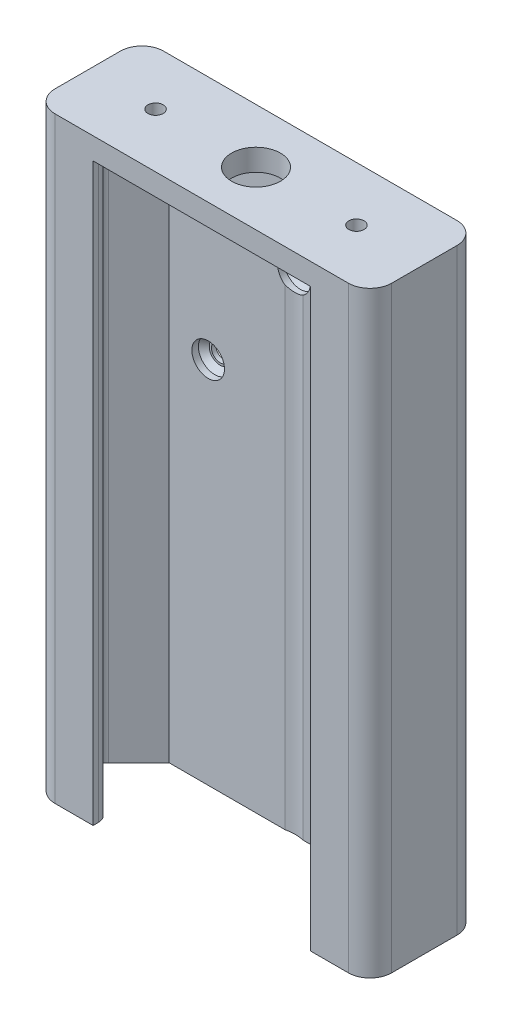
from build123d import *

# Parameters (mm, degrees)
SKETCH1_W           = 62
SKETCH1_H           = 110
SKETCH1_R           = 1.6
SKETCH1_R_2         = 1.7
BOSS_EXTRUDE1_DEPTH = 20
CUT_EXTRUDE1_START  = -55
CUT_EXTRUDE1_DEPTH  = 106
FILLET1_R           = 4
CUT_EXTRUDE3_REACH  = 118.022
SKETCH3_R           = 4.5
SKETCH3_R_2         = 1.4
SKETCH6_R           = 3
CUT_EXTRUDE5_DEPTH  = 2.2
SKETCH7_R           = 1.4
CUT_EXTRUDE6_DEPTH  = 10
SKETCH8_R           = 7.2
CUT_EXTRUDE7_DEPTH  = 110
CHAMFER1_SIZE       = 1
CUT_EXTRUDE8_DEPTH  = 0.3


# Read off the part's stored shape, not the designer's step: Cut-Extrude1
with BuildPart() as part:
    # Sketch1 → Boss-Extrude1 (new body)
    with BuildSketch(Plane.XY):
        Rectangle(SKETCH1_W, SKETCH1_H)
        with Locations((-15.807995258, 12.898531296)):
            Circle(SKETCH1_R, mode=Mode.SUBTRACT)
        with Locations(Location((15.691890368, 12.813645595, 0), (0, 0, 180))):
            Circle(SKETCH1_R, mode=Mode.SUBTRACT)
        with Locations((0, 34.398531296)):
            Circle(SKETCH1_R_2, mode=Mode.SUBTRACT)
    extrude(amount=BOSS_EXTRUDE1_DEPTH)

    # Cut-Extrude1 outline → Cut-Extrude1 (cut)
    with BuildSketch(Plane(origin=(0, 0, 0), x_dir=(1, 0, 0), z_dir=(0, 1, 0)).offset(CUT_EXTRUDE1_START)):
        with BuildLine():
            Line((-20, -19), (-20, -20))
            Line((-20, -20), (20, -20))
            Line((20, -20), (20, -19))
            ThreePointArc((20, -19), (20.585786438, -17.585786438), (22, -17))
            Line((22, -17), (23, -17))
            Line((23, -17), (28.585786438, -11.414213562))
            ThreePointArc((28.585786438, -11.414213562), (29.171572875, -10), (28.585786438, -8.585786438))
            Line((28.585786438, -8.585786438), (23, -3))
            Line((23, -3), (-23, -3))
            Line((-23, -3), (-28.585786438, -8.585786438))
            ThreePointArc((-28.585786438, -8.585786438), (-29.171572875, -10), (-28.585786438, -11.414213562))
            Line((-28.585786438, -11.414213562), (-23, -17))
            Line((-23, -17), (-22, -17))
            ThreePointArc((-22, -17), (-20.585786438, -17.585786438), (-20, -19))
        make_face()
    extrude(amount=CUT_EXTRUDE1_DEPTH, mode=Mode.SUBTRACT)

    # Fillet1
    fillet1_edges = [part.edges().sort_by_distance(p)[0] for p in [
        (-31, 0, 20),
        (31, 0, 20),
        (-31, 0, 0),
        (31, 0, 0),
    ]]
    fillet(fillet1_edges, radius=FILLET1_R)

    # Sketch3 → Cut-Extrude3 (cut, up to next)
    with BuildSketch(Plane.XZ.offset(-55), mode=Mode.PRIVATE) as cut_extrude3_sk1:
        with Locations(Location((0, 10, 0), (0, 0, 90))):
            Circle(SKETCH3_R)
    cut_extrude3_tool1 = extrude(cut_extrude3_sk1.sketch, amount=CUT_EXTRUDE3_REACH, mode=Mode.PRIVATE) & part.part
    # Sketch3 → Cut-Extrude3 (cut, up to next)
    with BuildSketch(Plane.XZ.offset(-55), mode=Mode.PRIVATE) as cut_extrude3_sk2:
        with Locations(Location((-18.5, 10, 0), (0, 0, 90))):
            Circle(SKETCH3_R_2)
    cut_extrude3_tool2 = extrude(cut_extrude3_sk2.sketch, amount=CUT_EXTRUDE3_REACH, mode=Mode.PRIVATE) & part.part
    # Sketch3 → Cut-Extrude3 (cut, up to next)
    with BuildSketch(Plane.XZ.offset(-55), mode=Mode.PRIVATE) as cut_extrude3_sk3:
        with Locations(Location((18.5, 10, 0), (0, 0, 90))):
            Circle(SKETCH3_R_2)
    cut_extrude3_tool3 = extrude(cut_extrude3_sk3.sketch, amount=CUT_EXTRUDE3_REACH, mode=Mode.PRIVATE) & part.part
    add(cut_extrude3_tool1.solids().sort_by_distance((0, 55, 10))[0], mode=Mode.SUBTRACT)
    add(cut_extrude3_tool2.solids().sort_by_distance((-18.5, 55, 10))[0], mode=Mode.SUBTRACT)
    add(cut_extrude3_tool3.solids().sort_by_distance((18.5, 55, 10))[0], mode=Mode.SUBTRACT)

    # Sketch6 → Cut-Extrude5 (cut)
    with BuildSketch(Plane.XY.offset(3)):
        with Locations((0, 34.398531296)):
            Circle(SKETCH6_R)
        with Locations((-15.807995258, 12.898531296)):
            Circle(SKETCH6_R)
        with Locations((15.691890368, 12.813645595)):
            Circle(SKETCH6_R)
    extrude(amount=-CUT_EXTRUDE5_DEPTH, mode=Mode.SUBTRACT)

    # Sketch7 → Cut-Extrude6 (cut)
    with BuildSketch(Plane.XZ.offset(55)):
        with Locations(Location((-27.002442772, 17, 0), (0, 0, 270))):
            Circle(SKETCH7_R)
        with Locations(Location((27.002442772, 17, 0), (0, 0, 270))):
            Circle(SKETCH7_R)
        with Locations(Location((-27.002442772, 3, 0), (0, 0, 270))):
            Circle(SKETCH7_R)
        with Locations(Location((27.002442772, 3, 0), (0, 0, 270))):
            Circle(SKETCH7_R)
    extrude(amount=-CUT_EXTRUDE6_DEPTH, mode=Mode.SUBTRACT)

    # Sketch8 → Cut-Extrude7 (cut)
    with BuildSketch(Plane.XZ.offset(-51)):
        with Locations((0, 10)):
            Circle(SKETCH8_R)
    extrude(amount=CUT_EXTRUDE7_DEPTH, mode=Mode.SUBTRACT)

    # Chamfer1
    chamfer1_edges = [part.edges().sort_by_distance(p)[0] for p in [
        (-3, 34.398531296, 0.8),
        (-18.807995258, 12.898531296, 0.8),
        (12.691890368, 12.813645595, 0.8),
    ]]
    chamfer(chamfer1_edges, length=CHAMFER1_SIZE)

    # Sketch9 → Cut-Extrude8 (cut)
    # profile 1 of 2: a face of its own
    with BuildSketch(Plane(origin=(0, 0, 0), x_dir=(-1, 0, 0), z_dir=(0, 0, -1))):
        with BuildLine():
            add(Edge.make_bspline(
                [(-2.359642103, -40.869937048), (-2.366490162, -41.151931615), (-2.38010366, -41.712518575), (-2.472068844, -42.5473989), (-2.628802751, -43.368211635), (-2.84585256, -44.172325229), (-3.121279045, -44.950453088), (-3.44898406, -45.697769639), (-3.827756547, -46.41143278), (-4.123987763, -46.858355539), (-4.271587513, -47.081038647)],
                knots=[0, 0, 0, 0, 1.02570576, 2.039036703, 3.051020505, 4.062612249, 5.06572321, 6.050573735, 7.0286816, 8, 8, 8, 8], degree=3))
            Line((-4.271587513, -47.081038647), (-9.666393634, -47.081038647))
            Line((-9.666393634, -47.081038647), (-9.996539806, -45.582682946))
            add(Edge.make_bspline(
                [(-9.996539806, -45.582682946), (-10.14409534, -45.697957028), (-10.431509355, -45.922492058), (-10.869944645, -46.223087922), (-11.299215504, -46.482575703), (-11.724372573, -46.702752792), (-12.163782019, -46.873706605), (-12.628911677, -46.992758282), (-13.123926076, -47.066551384), (-13.464625104, -47.076133491), (-13.639031631, -47.081038647)],
                knots=[0, 0, 0, 0, 1.115897672, 2.173585898, 3.166272313, 4.1043826, 5.024033154, 5.969893474, 6.960772407, 8, 8, 8, 8], degree=3))
            add(Edge.make_bspline(
                [(-13.639031631, -47.081038647), (-13.806149104, -47.075739072), (-14.133361149, -47.06536263), (-14.611857331, -46.996387871), (-15.06461494, -46.878140127), (-15.488188026, -46.702888819), (-15.891212237, -46.491468531), (-16.262863658, -46.220775798), (-16.612797338, -45.909220819), (-16.932003981, -45.548153889), (-17.218860457, -45.144364074), (-17.469177572, -44.700586731), (-17.680847705, -44.218170192), (-17.849369565, -43.697268538), (-17.983758614, -43.139317531), (-18.08076542, -42.54401749), (-18.139772876, -41.90994848), (-18.145608859, -41.474732573), (-18.148610655, -41.250874938)],
                knots=[0, 0, 0, 0, 0.965367221, 1.890166112, 2.786637287, 3.661058453, 4.533132026, 5.409449019, 6.309913162, 7.235318815, 8.187167351, 9.166390065, 10.173696982, 11.225334929, 12.325071294, 13.486270167, 14.707038033, 16, 16, 16, 16], degree=3))
            add(Edge.make_bspline(
                [(-18.148610655, -41.250874938), (-18.145380868, -41.028110504), (-18.13906092, -40.592211868), (-18.061823263, -39.955940866), (-17.951161993, -39.352277596), (-17.780501984, -38.786479049), (-17.57116908, -38.253279735), (-17.313027098, -37.754284855), (-17.00695431, -37.290552082), (-16.655361498, -36.86836102), (-16.271173219, -36.488646906), (-15.866792991, -36.153822947), (-15.441235023, -35.872831621), (-15.001210043, -35.636308906), (-14.538246693, -35.46005068), (-14.05827439, -35.331504815), (-13.560550133, -35.253717056), (-13.22208709, -35.244143196), (-13.051298887, -35.239312233)],
                knots=[0, 0, 0, 0, 1.212977988, 2.373518261, 3.487390636, 4.552674673, 5.587761779, 6.604441166, 7.607688169, 8.609051098, 9.59210347, 10.547088745, 11.464443304, 12.366334919, 13.263230802, 14.156634918, 15.069839334, 16, 16, 16, 16], degree=3))
            add(Edge.make_bspline(
                [(-13.051298887, -35.239312233), (-12.907274101, -35.240632655), (-12.625883467, -35.243212451), (-12.218904671, -35.285359876), (-11.836609306, -35.345488626), (-11.475422758, -35.434321152), (-11.119547919, -35.551665956), (-10.756450756, -35.6884669), (-10.378029539, -35.849149594), (-10.126545435, -35.973291961), (-9.996539806, -36.037467812)],
                knots=[0, 0, 0, 0, 1.082761885, 2.115462637, 3.073996182, 3.991740963, 4.909350507, 5.890912607, 6.909699543, 8, 8, 8, 8], degree=3))
            Line((-9.996539806, -36.037467812), (-9.996539806, -35.471502947))
            Line((-9.996539806, -35.471502947), (-7.932219239, -35.471502947))
            Line((-7.932219239, -35.471502947), (-7.932219239, -45.687894363))
            Line((-7.932219239, -45.687894363), (-5.17858249, -45.687894363))
            add(Edge.make_bspline(
                [(-5.17858249, -45.687894363), (-5.100199495, -45.526052846), (-4.93737901, -45.189868776), (-4.752347082, -44.637431036), (-4.582006037, -44.034338911), (-4.455390441, -43.385409375), (-4.353301854, -42.727831452), (-4.276375568, -42.090216935), (-4.22556933, -41.489943707), (-4.219901002, -41.101010757), (-4.217167815, -40.913472806)],
                knots=[0, 0, 0, 0, 0.878623297, 1.825113616, 2.843903906, 3.942345251, 5.055716139, 6.098163312, 7.082961326, 8, 8, 8, 8], degree=3))
            add(Edge.make_bspline(
                [(-4.217167815, -40.913472806), (-4.222938621, -40.585477325), (-4.234253778, -39.942357371), (-4.337523575, -39.002010311), (-4.50715849, -38.107436026), (-4.746167484, -37.261138657), (-5.050277167, -36.465343929), (-5.416401188, -35.724840139), (-5.849032863, -35.042697411), (-6.188726739, -34.63369369), (-6.357675959, -34.430272714)],
                knots=[0, 0, 0, 0, 1.127507235, 2.210769482, 3.248117636, 4.255109998, 5.230456955, 6.173289322, 7.091472155, 8, 8, 8, 8], degree=3))
            add(Edge.make_bspline(
                [(-6.357675959, -34.430272714), (-6.539460891, -34.240439808), (-6.903169572, -33.860629033), (-7.532009209, -33.375099312), (-8.218546769, -32.953644298), (-8.969907582, -32.607874224), (-9.7752075, -32.325246818), (-10.637602542, -32.133941426), (-11.549313664, -32.009573129), (-12.17531622, -31.995735625), (-12.496217961, -31.988642237)],
                knots=[0, 0, 0, 0, 0.925501549, 1.851709842, 2.791283969, 3.760219851, 4.761999353, 5.79415392, 6.869238087, 8, 8, 8, 8], degree=3))
            add(Edge.make_bspline(
                [(-12.496217961, -31.988642237), (-12.808769094, -31.996226467), (-13.422360651, -32.011115612), (-14.321600458, -32.151767911), (-15.182075689, -32.368887026), (-15.994692147, -32.685994215), (-16.761397102, -33.067998505), (-17.469925895, -33.52262568), (-18.13092868, -34.02758945), (-18.520311748, -34.41726301), (-18.71457552, -34.611671709)],
                knots=[0, 0, 0, 0, 1.080083285, 2.120388995, 3.139739741, 4.143139387, 5.130595913, 6.09696489, 7.050573046, 8, 8, 8, 8], degree=3))
            add(Edge.make_bspline(
                [(-18.71457552, -34.611671709), (-18.900262876, -34.818558752), (-19.272749593, -35.233571799), (-19.758267295, -35.926455194), (-20.172030106, -36.68134855), (-20.533494608, -37.483430401), (-20.814891053, -38.332315214), (-21.01704668, -39.212910643), (-21.145719918, -40.119988838), (-21.159920659, -40.734063173), (-21.167089937, -41.044080083)],
                knots=[0, 0, 0, 0, 0.94572817, 1.897119915, 2.871949853, 3.872610245, 4.888023182, 5.910587589, 6.9451551, 8, 8, 8, 8], degree=3))
            add(Edge.make_bspline(
                [(-21.167089937, -41.044080083), (-21.159337014, -41.373351399), (-21.14409512, -42.020683798), (-21.026759161, -42.969300288), (-20.83099378, -43.875553944), (-20.5560291, -44.734484735), (-20.207376426, -45.542195933), (-19.792058428, -46.290942566), (-19.319138916, -46.986781395), (-18.944645973, -47.396005507), (-18.758111279, -47.599839774)],
                knots=[0, 0, 0, 0, 1.103587479, 2.169602684, 3.198550546, 4.207538862, 5.188068988, 6.142541187, 7.074800959, 8, 8, 8, 8], degree=3))
            add(Edge.make_bspline(
                [(-18.758111279, -47.599839774), (-18.554561311, -47.798486202), (-18.149116897, -48.194163418), (-17.462632596, -48.69477679), (-16.734918632, -49.133666176), (-15.950916773, -49.482436142), (-15.126273427, -49.759878842), (-14.261658066, -49.953285907), (-13.362092452, -50.07784405), (-12.749386984, -50.092217235), (-12.438170282, -50.099517929)],
                knots=[0, 0, 0, 0, 0.976059301, 1.944180068, 2.911149962, 3.891180839, 4.885820732, 5.895790178, 6.931190801, 8, 8, 8, 8], degree=3))
            add(Edge.make_bspline(
                [(-12.438170282, -50.099517929), (-12.084912697, -50.093067369), (-11.367881151, -50.079974218), (-10.287344715, -50.000007685), (-9.21211228, -49.863377784), (-8.509375442, -49.710287013), (-8.164409953, -49.635136501)],
                knots=[0, 0, 0, 0, 0.984037569, 1.997369649, 3.016931631, 4, 4, 4, 4], degree=3))
            Line((-8.164409953, -49.635136501), (-8.164409953, -51.304007258))
            add(Edge.make_bspline(
                [(-8.164409953, -51.304007258), (-8.358856223, -51.342927802), (-8.739501471, -51.419118105), (-9.304095518, -51.507041033), (-9.846534493, -51.586301331), (-10.549110274, -51.657420547), (-11.428712123, -51.712424016), (-12.13453869, -51.72066994), (-12.492589981, -51.724852927)],
                knots=[0, 0, 0, 0, 0.81922183, 1.603696978, 2.36048962, 3.083886659, 4.520715716, 6, 6, 6, 6], degree=3))
            add(Edge.make_bspline(
                [(-12.492589981, -51.724852927), (-12.680092952, -51.723025806), (-13.053039674, -51.719391628), (-13.60635502, -51.682221454), (-14.149973467, -51.620691268), (-14.682403255, -51.533103514), (-15.205243373, -51.424013775), (-15.71972009, -51.294809275), (-16.221339917, -51.134222974), (-16.873050624, -50.893499505), (-17.650737307, -50.539942391), (-18.524230285, -50.031862504), (-19.331946919, -49.449657293), (-19.813496739, -48.99948378), (-20.053300106, -48.775305263)],
                knots=[0, 0, 0, 0, 0.810470385, 1.612039914, 2.396044944, 3.174715653, 3.943691338, 4.704466526, 5.466677343, 6.21928978, 7.707211333, 9.152618295, 10.582053839, 12, 12, 12, 12], degree=3))
            add(Edge.make_bspline(
                [(-20.053300106, -48.775305263), (-20.280349653, -48.533428331), (-20.735271052, -48.048798462), (-21.317441598, -47.229705247), (-21.829374505, -46.34748624), (-22.184945965, -45.558445029), (-22.432031826, -44.898634065), (-22.584874752, -44.383146729), (-22.726987694, -43.858446709), (-22.831588266, -43.317008852), (-22.922577324, -42.765876141), (-22.975643728, -42.200878616), (-23.020944755, -41.624068776), (-23.023382823, -41.234043191), (-23.024615649, -41.036824123)],
                knots=[0, 0, 0, 0, 1.402421099, 2.80992134, 4.240617462, 5.713175065, 6.466049945, 7.220401648, 7.987473213, 8.765257923, 9.552729452, 10.350131408, 11.165732817, 12, 12, 12, 12], degree=3))
            add(Edge.make_bspline(
                [(-23.024615649, -41.036824123), (-23.021160169, -40.849342332), (-23.014309894, -40.477671301), (-22.979868054, -39.925160466), (-22.911326085, -39.383468256), (-22.828088445, -38.850866036), (-22.708879622, -38.328519447), (-22.568348361, -37.816537369), (-22.405469203, -37.311714227), (-22.149114935, -36.660190208), (-21.780718323, -35.876030833), (-21.253472718, -34.995688724), (-20.662891434, -34.170695932), (-20.202859177, -33.680580491), (-19.973484548, -33.43620622)],
                knots=[0, 0, 0, 0, 0.803427895, 1.59274601, 2.370429791, 3.142221944, 3.901528245, 4.664573604, 5.416703071, 6.173033217, 7.663421849, 9.122596363, 10.565310625, 12, 12, 12, 12], degree=3))
            add(Edge.make_bspline(
                [(-19.973484548, -33.43620622), (-19.731360686, -33.204796037), (-19.246710205, -32.741590737), (-18.434338887, -32.139625515), (-17.557733859, -31.616178402), (-16.782015245, -31.241430788), (-16.133509796, -30.987159471), (-15.634881184, -30.819157065), (-15.127220282, -30.6786803), (-14.611916272, -30.560683154), (-14.087953748, -30.476466772), (-13.557113981, -30.408081362), (-13.016680724, -30.373688462), (-12.653467324, -30.366780814), (-12.470822102, -30.363307239)],
                knots=[0, 0, 0, 0, 1.447639235, 2.897686521, 4.361781269, 5.859176572, 6.617840476, 7.373812504, 8.134043767, 8.895479877, 9.65914084, 10.428655884, 11.209835056, 12, 12, 12, 12], degree=3))
            add(Edge.make_bspline(
                [(-12.470822102, -30.363307239), (-12.273655478, -30.365141485), (-11.885020308, -30.368756968), (-11.311006846, -30.405027435), (-10.753776813, -30.469955119), (-10.211139039, -30.544192561), (-9.685716598, -30.657630477), (-9.174859953, -30.785086966), (-8.681323112, -30.942322561), (-8.05058495, -31.17833017), (-7.300290916, -31.522162597), (-6.467934384, -32.022060037), (-5.7008294, -32.591886132), (-5.253417018, -33.036334622), (-5.029835314, -33.258435204)],
                knots=[0, 0, 0, 0, 0.864087369, 1.703202784, 2.519131759, 3.322675115, 4.102298747, 4.873608329, 5.629614526, 6.370930119, 7.824649208, 9.239032121, 10.620284268, 12, 12, 12, 12], degree=3))
            add(Edge.make_bspline(
                [(-5.029835314, -33.258435204), (-4.821058514, -33.494644825), (-4.401501406, -33.969330834), (-3.869001121, -34.769853526), (-3.410651204, -35.636842547), (-3.030395843, -36.571784913), (-2.730130383, -37.567809998), (-2.511899485, -38.619978964), (-2.384589421, -39.727606697), (-2.368074253, -40.483831395), (-2.359642103, -40.869937048)],
                knots=[0, 0, 0, 0, 0.915012431, 1.838805702, 2.784957874, 3.760365265, 4.766245593, 5.803280842, 6.878421076, 8, 8, 8, 8], degree=3))
        make_face()
        with BuildLine():
            Line((-10.021935665, -43.971859867), (-10.021935665, -37.746246348))
            add(Edge.make_bspline(
                [(-10.021935665, -37.746246348), (-10.145861708, -37.690280896), (-10.385280532, -37.582158484), (-10.742018665, -37.450744114), (-11.075940599, -37.335123057), (-11.500920623, -37.218926779), (-12.041344487, -37.113530601), (-12.481101382, -37.102496855), (-12.706640796, -37.096837945)],
                knots=[0, 0, 0, 0, 0.878508615, 1.697234041, 2.456014726, 3.161391463, 4.544154485, 6, 6, 6, 6], degree=3))
            add(Edge.make_bspline(
                [(-12.706640796, -37.096837945), (-12.833784768, -37.100486466), (-13.083060765, -37.107639686), (-13.445429754, -37.158627066), (-13.786940168, -37.242810789), (-14.108132156, -37.357993255), (-14.408541384, -37.511090313), (-14.683833914, -37.703330966), (-14.945286273, -37.919510749), (-15.175899712, -38.176064178), (-15.3849718, -38.461014231), (-15.565296424, -38.776625214), (-15.717865941, -39.121117327), (-15.845425595, -39.492225616), (-15.942578838, -39.893094338), (-16.01081195, -40.322558159), (-16.050167349, -40.780919125), (-16.055929386, -41.096004479), (-16.058894229, -41.258130898)],
                knots=[0, 0, 0, 0, 1.007957755, 1.976182339, 2.894800904, 3.792666772, 4.676079958, 5.559076734, 6.450416319, 7.359881162, 8.286224163, 9.248399813, 10.235620221, 11.269648407, 12.355717848, 13.501761907, 14.714537545, 16, 16, 16, 16], degree=3))
            add(Edge.make_bspline(
                [(-16.058894229, -41.258130898), (-16.056964941, -41.416619758), (-16.053219819, -41.72427749), (-16.019897875, -42.169908187), (-15.968070103, -42.586210774), (-15.885878075, -42.970660401), (-15.791531009, -43.329133567), (-15.665610324, -43.655156637), (-15.527422653, -43.956044365), (-15.357697188, -44.22213464), (-15.169719395, -44.461105204), (-14.953503643, -44.666468442), (-14.710702706, -44.837988406), (-14.445318175, -44.98025146), (-14.154559554, -45.088986574), (-13.840972172, -45.169041654), (-13.501418543, -45.216625544), (-13.26671447, -45.221168923), (-13.145626364, -45.223512935)],
                knots=[0, 0, 0, 0, 1.354199601, 2.628765049, 3.81707487, 4.935897751, 5.98643329, 6.980714442, 7.919124953, 8.810847782, 9.671113892, 10.511788832, 11.349154015, 12.204501966, 13.077829295, 13.995233323, 14.965704365, 16, 16, 16, 16], degree=3))
            add(Edge.make_bspline(
                [(-13.145626364, -45.223512935), (-13.00859538, -45.220002621), (-12.73259941, -45.21293245), (-12.322805658, -45.133430079), (-11.9101278, -45.023642978), (-11.372543968, -44.801260212), (-10.726472008, -44.468884665), (-10.254306176, -44.135788822), (-10.021935665, -43.971859867)],
                knots=[0, 0, 0, 0, 0.719920548, 1.450001767, 2.189338139, 2.963153925, 4.505454173, 6, 6, 6, 6], degree=3))
        make_face(mode=Mode.SUBTRACT)
    # profile 2 of 2: a face of its own
    with BuildSketch(Plane(origin=(0, 0, 0), x_dir=(-1, 0, 0), z_dir=(0, 0, -1))):
        Polygon((23.645717866, -30.827688667), (18.911204088, -49.170755073), (16.182963198, -49.170755073), (12.355444397, -33.944123406), (8.611369134, -49.170755073), (5.944803903, -49.170755073), (1.123218607, -30.827688667), (3.521313325, -30.827688667), (7.435903644, -46.079716193), (11.205374767, -30.827688667), (13.661517163, -30.827688667), (17.467268085, -46.224835389), (21.247623148, -30.827688667), align=None)
    extrude(amount=-CUT_EXTRUDE8_DEPTH, mode=Mode.SUBTRACT)


solid = part.part
